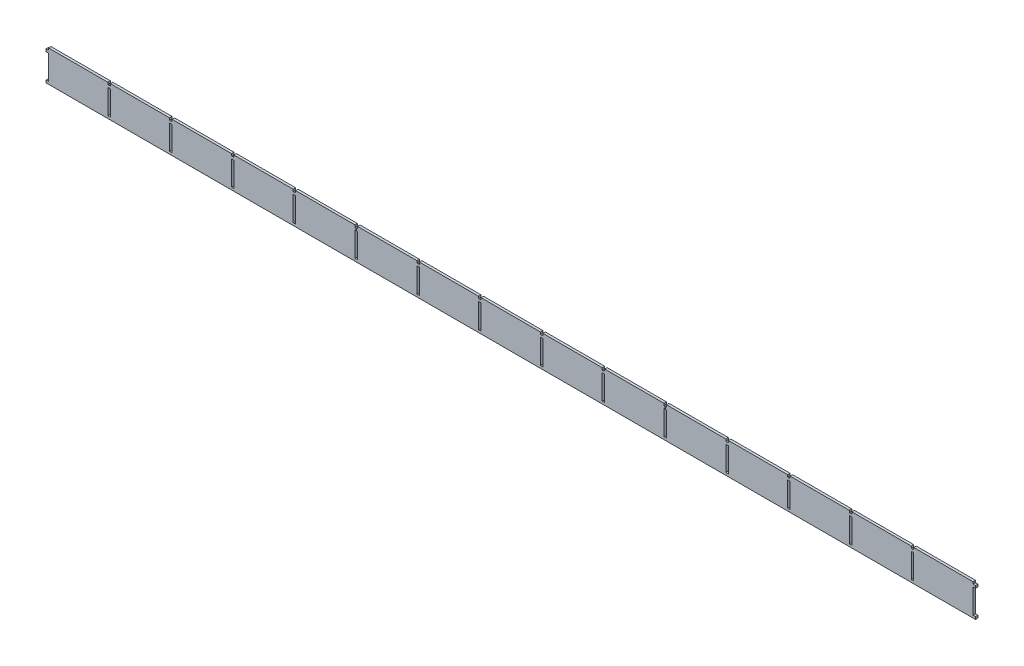
from build123d import *

# Parameters (mm, degrees)
BOSS_EXTRUDE1_DEPTH = 4


with BuildPart() as part:
    # Sketch1 → Boss-Extrude1 (new body)
    with BuildSketch(Plane.XY):
        Polygon((-444.639963834, 123.247292698), (-540.639963834, 123.247292698), (-540.639963834, 119.96651031), (-544.639963834, 119.96651031), (-544.639963834, 115.96651031), (-540.639963834, 115.96651031), (-540.639963834, 76.309294689), (-544.639963834, 76.309294689), (-544.639963834, 72.309294689), (959.360036166, 72.309294689), (959.360036166, 76.309294689), (955.360036166, 76.309294689), (955.360036166, 115.96651031), (959.360036166, 115.96651031), (959.360036166, 119.96651031), (955.360036166, 119.96651031), (955.360036166, 123.247292698), (859.360036166, 123.247292698), (859.360036166, 119.96651031), (857.460036166, 119.96651031), (857.460036166, 115.96651031), (859.360036166, 115.96651031), (859.360036166, 76.309294689), (855.360036166, 76.309294689), (855.360036166, 115.96651031), (857.260036166, 115.96651031), (857.260036166, 119.96651031), (855.360036166, 119.96651031), (855.360036166, 123.247292698), (759.360036166, 123.247292698), (759.360036166, 119.96651031), (757.460036166, 119.96651031), (757.460036166, 115.96651031), (759.360036166, 115.96651031), (759.360036166, 76.309294689), (755.360036166, 76.309294689), (755.360036166, 115.96651031), (757.260036166, 115.96651031), (757.260036166, 119.96651031), (755.360036166, 119.96651031), (755.360036166, 123.247292698), (659.360036166, 123.247292698), (659.360036166, 119.96651031), (657.460036166, 119.96651031), (657.460036166, 115.96651031), (659.360036166, 115.96651031), (659.360036166, 76.309294689), (655.360036166, 76.309294689), (655.360036166, 115.96651031), (657.260036166, 115.96651031), (657.260036166, 119.96651031), (655.360036166, 119.96651031), (655.360036166, 123.247292698), (559.360036166, 123.247292698), (559.360036166, 119.96651031), (557.460036166, 119.96651031), (557.460036166, 115.96651031), (559.360036166, 115.96651031), (559.360036166, 76.309294689), (555.360036166, 76.309294689), (555.360036166, 115.96651031), (557.260036166, 115.96651031), (557.260036166, 119.96651031), (555.360036166, 119.96651031), (555.360036166, 123.247292698), (459.360036166, 123.247292698), (459.360036166, 119.96651031), (457.460036166, 119.96651031), (457.460036166, 115.96651031), (459.360036166, 115.96651031), (459.360036166, 76.309294689), (455.360036166, 76.309294689), (455.360036166, 115.96651031), (457.260036166, 115.96651031), (457.260036166, 119.96651031), (455.360036166, 119.96651031), (455.360036166, 123.247292698), (359.360036166, 123.247292698), (359.360036166, 119.96651031), (357.460036166, 119.96651031), (357.460036166, 115.96651031), (359.360036166, 115.96651031), (359.360036166, 76.309294689), (355.360036166, 76.309294689), (355.360036166, 115.96651031), (357.260036166, 115.96651031), (357.260036166, 119.96651031), (355.360036166, 119.96651031), (355.360036166, 123.247292698), (259.360036166, 123.247292698), (259.360036166, 119.96651031), (257.460036166, 119.96651031), (257.460036166, 115.96651031), (259.360036166, 115.96651031), (259.360036166, 76.309294689), (255.360036166, 76.309294689), (255.360036166, 115.96651031), (257.260036166, 115.96651031), (257.260036166, 119.96651031), (255.360036166, 119.96651031), (255.360036166, 123.247292698), (159.360036166, 123.247292698), (159.360036166, 119.96651031), (157.460036166, 119.96651031), (157.460036166, 115.96651031), (159.360036166, 115.96651031), (159.360036166, 76.309294689), (155.360036166, 76.309294689), (155.360036166, 115.96651031), (157.260036166, 115.96651031), (157.260036166, 119.96651031), (155.360036166, 119.96651031), (155.360036166, 123.247292698), (59.360036166, 123.247292698), (59.360036166, 119.96651031), (57.460036166, 119.96651031), (57.460036166, 115.96651031), (59.360036166, 115.96651031), (59.360036166, 76.309294689), (55.360036166, 76.309294689), (55.360036166, 115.96651031), (57.260036166, 115.96651031), (57.260036166, 119.96651031), (55.360036166, 119.96651031), (55.360036166, 123.247292698), (-40.639963834, 123.247292698), (-40.639963834, 119.96651031), (-42.539963834, 119.96651031), (-42.539963834, 115.96651031), (-40.639963834, 115.96651031), (-40.639963834, 76.309294689), (-44.639963834, 76.309294689), (-44.639963834, 115.96651031), (-42.739963834, 115.96651031), (-42.739963834, 119.96651031), (-44.639963834, 119.96651031), (-44.639963834, 123.247292698), (-140.639963834, 123.247292698), (-140.639963834, 119.96651031), (-142.539963834, 119.96651031), (-142.539963834, 115.96651031), (-140.639963834, 115.96651031), (-140.639963834, 76.309294689), (-144.639963834, 76.309294689), (-144.639963834, 115.96651031), (-142.739963834, 115.96651031), (-142.739963834, 119.96651031), (-144.639963834, 119.96651031), (-144.639963834, 123.247292698), (-240.639963834, 123.247292698), (-240.639963834, 119.96651031), (-242.539963834, 119.96651031), (-242.539963834, 115.96651031), (-240.639963834, 115.96651031), (-240.639963834, 76.309294689), (-244.639963834, 76.309294689), (-244.639963834, 115.96651031), (-242.739963834, 115.96651031), (-242.739963834, 119.96651031), (-244.639963834, 119.96651031), (-244.639963834, 123.247292698), (-340.639963834, 123.247292698), (-340.639963834, 119.96651031), (-342.539963834, 119.96651031), (-342.539963834, 115.96651031), (-340.639963834, 115.96651031), (-340.639963834, 76.309294689), (-344.639963834, 76.309294689), (-344.639963834, 115.96651031), (-342.739963834, 115.96651031), (-342.739963834, 119.96651031), (-344.639963834, 119.96651031), (-344.639963834, 123.247292698), (-440.639963834, 123.247292698), (-440.639963834, 119.96651031), (-442.539963834, 119.96651031), (-442.539963834, 115.96651031), (-440.639963834, 115.96651031), (-440.639963834, 76.309294689), (-444.639963834, 76.309294689), (-444.639963834, 115.96651031), (-442.739963834, 115.96651031), (-442.739963834, 119.96651031), (-444.639963834, 119.96651031), align=None)
    extrude(amount=BOSS_EXTRUDE1_DEPTH)


solid = part.part
